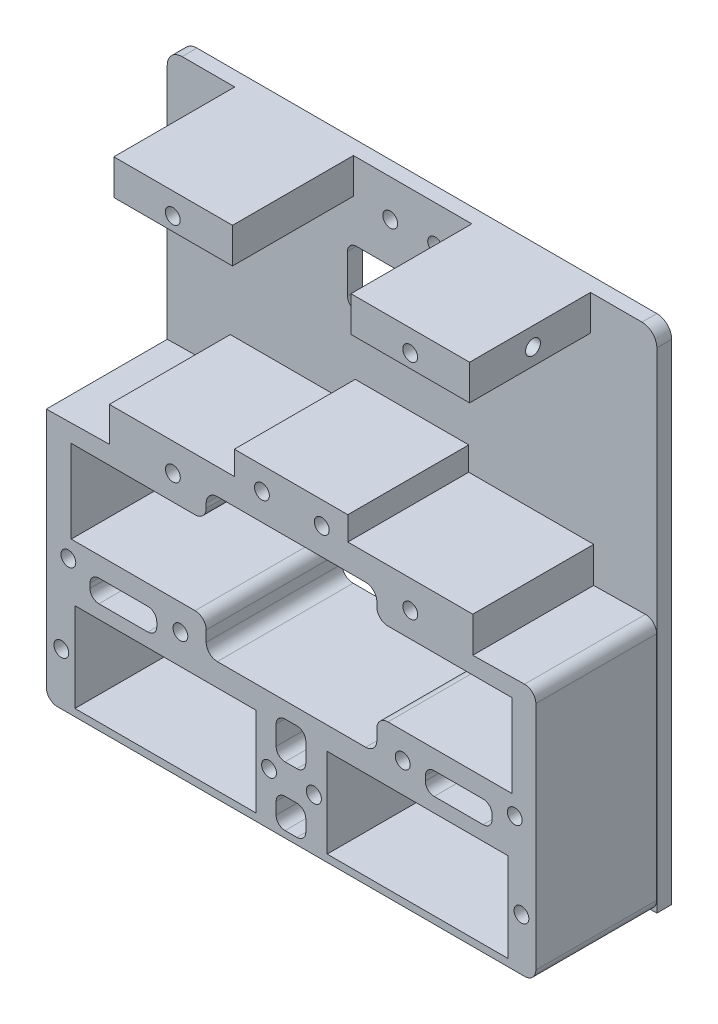
from build123d import *

# Parameters (mm, degrees)
SKETCH1_W           = 66
SKETCH1_H           = 68
SKETCH1_R           = 1
SKETCH1_W_2         = 17.8
SKETCH1_H_2         = 7.6
BOSS_EXTRUDE1_DEPTH = 2
SKETCH2_W           = 16
SKETCH2_H           = 4.75
BOSS_EXTRUDE2_DEPTH = 16.3
BOSS_EXTRUDE3_DEPTH = 16.3
SKETCH4_W           = 24.4
SKETCH4_H           = 12
CUT_EXTRUDE1_DEPTH  = 441.19004389
SKETCH5_W           = 9
SKETCH5_H           = 3
CUT_EXTRUDE2_DEPTH  = 441.19004389
SKETCH6_W           = 4
SKETCH6_H           = 5
SKETCH6_H_2         = 4
CUT_EXTRUDE3_DEPTH  = 441.19004389
SKETCH7_R           = 1
SKETCH7_R_2         = 1.021070593
CUT_EXTRUDE4_DEPTH  = 441.19004389
FILLET1_R           = 1.5
FILLET2_R           = 1.2
FILLET3_R           = 2
SKETCH8_R           = 1
CUT_EXTRUDE5_DEPTH  = 441.19004389
SKETCH9_R           = 1
CUT_EXTRUDE6_DEPTH  = 6.5
SKETCH10_R          = 1
CUT_EXTRUDE7_DEPTH  = 6.5
SKETCH11_R          = 1
CUT_EXTRUDE8_DEPTH  = 6.3


with BuildPart() as part:
    # Sketch1 → Boss-Extrude1 (new body)
    with BuildSketch(Plane.XY.offset(30)):
        with Locations((251.940861289, 301.024014524)):
            Rectangle(SKETCH1_W, SKETCH1_H)
        with Locations((249.003592831, 330.031505481)):
            Circle(SKETCH1_R, mode=Mode.SUBTRACT)
        with Locations((255.055282531, 330.031505481)):
            Circle(SKETCH1_R, mode=Mode.SUBTRACT)
        with Locations((252.135035756, 320.823888471)):
            Rectangle(SKETCH1_W_2, SKETCH1_H_2, mode=Mode.SUBTRACT)
    extrude(amount=BOSS_EXTRUDE1_DEPTH)

    # Sketch2 → Boss-Extrude2 (add)
    with BuildSketch(Plane.XY.offset(32)):
        with Locations((236.037971242, 332.649014524)):
            Rectangle(SKETCH2_W, SKETCH2_H)
        with Locations((268, 332.649014524)):
            Rectangle(SKETCH2_W, SKETCH2_H)
    extrude(amount=BOSS_EXTRUDE2_DEPTH)

    # Sketch3 → Boss-Extrude3 (add)
    with BuildSketch(Plane.XY.offset(32)):
        Polygon((218.940861289, 301.024014524), (227.440861289, 301.162994385), (227.440861289, 305.822042144), (244.283938871, 305.822042144), (244.283938871, 309.015037829), (259.583938871, 309.015037829), (259.583938871, 305.822042144), (276.427016453, 305.822042144), (276.427016453, 301.022054351), (284.927016453, 301.161034212), (284.927016453, 267.024014524), (218.940861289, 267.024014524), align=None)
    extrude(amount=BOSS_EXTRUDE3_DEPTH)

    # Sketch4 → Cut-Extrude1 (cut, through all)
    with BuildSketch(Plane.XY.offset(48.3)):
        Polygon((222.292892456, 298.707092285), (240.492892456, 298.707092285), (240.492892456, 302.33213739), (263.492892456, 302.33213739), (263.492892456, 298.718047727), (281.692892456, 298.718047727), (281.692892456, 287.526982505), (263.492892456, 287.526982505), (263.492892456, 283.070220947), (240.492892456, 283.070220947), (240.492892456, 287.516027063), (222.292892456, 287.516027063), align=None)
        with Locations((269.000012207, 274)):
            Rectangle(SKETCH4_W, SKETCH4_H)
        with Locations((235.000003052, 274)):
            Rectangle(SKETCH4_W, SKETCH4_H)
    extrude(amount=-CUT_EXTRUDE1_DEPTH, mode=Mode.SUBTRACT)

    # Sketch5 → Cut-Extrude2 (cut, through all)
    with BuildSketch(Plane.XY.offset(48.3)):
        with Locations((274.525158894, 283.446375987)):
            Rectangle(SKETCH5_W, SKETCH5_H)
        with Locations((229.329304238, 283.337005615)):
            Rectangle(SKETCH5_W, SKETCH5_H)
    extrude(amount=-CUT_EXTRUDE2_DEPTH, mode=Mode.SUBTRACT)

    # Sketch6 → Cut-Extrude3 (cut, through all)
    with BuildSketch(Plane.XY.offset(48.3)):
        with Locations((251.916786234, 278.429140424)):
            Rectangle(SKETCH6_W, SKETCH6_H)
        with Locations((251.916786234, 269.906464851)):
            Rectangle(SKETCH6_W, SKETCH6_H_2)
    extrude(amount=-CUT_EXTRUDE3_DEPTH, mode=Mode.SUBTRACT)

    # Sketch7 → Cut-Extrude4 (cut, through all)
    with BuildSketch(Plane.XY.offset(48.3)):
        with Locations((248.003059288, 305.943814451)):
            Circle(SKETCH7_R)
        with Locations((256.067937584, 305.943814451)):
            Circle(SKETCH7_R)
        with Locations((268.009326043, 302.047231613)):
            Circle(SKETCH7_R)
        with Locations((235.999760795, 302.047231613)):
            Circle(SKETCH7_R)
        with Locations((221.910888085, 285.07153078)):
            Circle(SKETCH7_R)
        with Locations((237.015406487, 284.015838633)):
            Circle(SKETCH7_R)
        with Locations((220.965503346, 274.032606797)):
            Circle(SKETCH7_R)
        with Locations((248.961423741, 274.032606797)):
            Circle(SKETCH7_R)
        with Locations((254.999359262, 274.032606797)):
            Circle(SKETCH7_R_2)
        with Locations((266.989260963, 284.015838633)):
            Circle(SKETCH7_R)
        with Locations((282.088512959, 285.07153078)):
            Circle(SKETCH7_R)
        with Locations((282.98591942, 274.032606797)):
            Circle(SKETCH7_R)
    extrude(amount=-CUT_EXTRUDE4_DEPTH, mode=Mode.SUBTRACT)

    # Fillet1
    fillet1_edges = [part.edges().sort_by_distance(p)[0] for p in [
        (240.492892456, 287.516027063, 39.15),
        (240.492892456, 283.070220947, 39.15),
        (263.492892456, 283.070220947, 39.15),
        (263.492892456, 287.526982505, 39.15),
        (240.492892456, 298.707092285, 39.15),
        (240.492892456, 302.33213739, 39.15),
        (263.492892456, 298.718047727, 39.15),
        (263.492892456, 302.33213739, 39.15),
        (218.940861289, 267.024014524, 39.15),
        (284.927016453, 267.024014524, 40.15),
        (284.927016453, 301.161034212, 40.15),
    ]]
    fillet(fillet1_edges, radius=FILLET1_R)

    # Fillet2
    fillet2_edges = [part.edges().sort_by_distance(p)[0] for p in [
        (253.916786234, 275.929140424, 39.15),
        (253.916786234, 267.906464851, 39.15),
        (249.916786234, 267.906464851, 39.15),
        (249.916786234, 275.929140424, 39.15),
        (253.916786234, 271.906464851, 39.15),
        (253.916786234, 280.929140424, 39.15),
        (249.916786234, 271.906464851, 39.15),
        (249.916786234, 280.929140424, 39.15),
        (224.829304238, 284.837005615, 39.15),
        (233.829304238, 284.837005615, 39.15),
        (233.829304238, 281.837005615, 39.15),
        (224.829304238, 281.837005615, 39.15),
        (270.025158894, 281.946375987, 39.15),
        (270.025158894, 284.946375987, 39.15),
        (279.025158894, 281.946375987, 39.15),
        (279.025158894, 284.946375987, 39.15),
        (243.235035756, 317.023888471, 31),
        (261.035035756, 317.023888471, 31),
        (261.035035756, 324.623888471, 31),
        (243.235035756, 324.623888471, 31),
    ]]
    fillet(fillet2_edges, radius=FILLET2_R)

    # Fillet3
    fillet3_edges = [part.edges().sort_by_distance(p)[0] for p in [
        (284.940861289, 335.024014524, 31),
        (218.940861289, 335.024014524, 31),
    ]]
    fillet(fillet3_edges, radius=FILLET3_R)

    # Sketch8 → Cut-Extrude5 (cut, through all)
    with BuildSketch(Plane.XY.offset(48.3)):
        with Locations((267.990854058, 332.085596795)):
            Circle(SKETCH8_R)
        with Locations((235.98446718, 332.085596795)):
            Circle(SKETCH8_R)
    extrude(amount=-CUT_EXTRUDE5_DEPTH, mode=Mode.SUBTRACT)

    # Sketch9 → Cut-Extrude6 (cut)
    with BuildSketch(Plane.ZY.offset(-228.037971242)):
        with Locations((39.737317207, 332.521446832)):
            Circle(SKETCH9_R)
    extrude(amount=-CUT_EXTRUDE6_DEPTH, mode=Mode.SUBTRACT)

    # Sketch10 → Cut-Extrude7 (cut)
    with BuildSketch(Plane(origin=(276, 0, 0), x_dir=(0, 0, -1), z_dir=(1, 0, 0))):
        with Locations((-39.750621675, 332.516774296)):
            Circle(SKETCH10_R)
    extrude(amount=-CUT_EXTRUDE7_DEPTH, mode=Mode.SUBTRACT)

    # Sketch11 → Cut-Extrude8 (cut)
    with BuildSketch(Plane.ZY.offset(-227.440861289)):
        with Locations((39.876392185, 303.349550232)):
            Circle(SKETCH11_R)
    extrude(amount=-CUT_EXTRUDE8_DEPTH, mode=Mode.SUBTRACT)


solid = part.part
